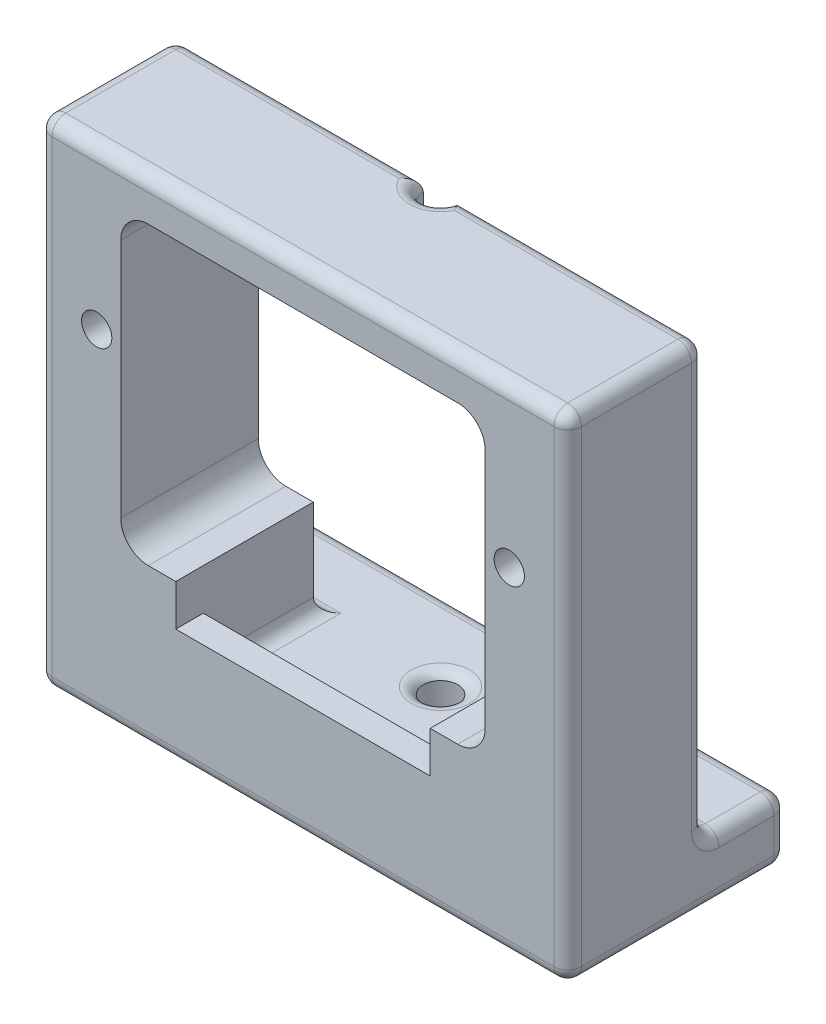
from build123d import *

# Parameters (mm, degrees)
SKETCH1_R           = 1.1
BOSS_EXTRUDE1_DEPTH = 10
SKETCH2_W           = 10
SKETCH2_H           = 8
SKETCH2_H_2         = 2
BOSS_EXTRUDE2_DEPTH = 4
SKETCH3_W           = 38.5
SKETCH3_H           = 10
BOSS_EXTRUDE3_DEPTH = 4.5
SKETCH4_W           = 38.5
SKETCH4_H           = 6
BOSS_EXTRUDE4_DEPTH = 4.5
SKETCH5_R           = 2.375
CUT_EXTRUDE1_DEPTH  = 4
SKETCH6_R           = 1.25
CUT_EXTRUDE2_DEPTH  = 39.659571907
FILLET1_R           = 1
FILLET2_R           = 1


with BuildPart() as part:
    # Sketch1 → Boss-Extrude1 (new body)
    with BuildSketch(Plane.XY):
        with BuildLine():
            ThreePointArc((-13.25, 8.75), (-12.664213562, 10.164213562), (-11.25, 10.75))
            Line((-11.25, 10.75), (11.25, 10.75))
            ThreePointArc((11.25, 10.75), (12.664213562, 10.164213562), (13.25, 8.75))
            Line((13.25, 8.75), (13.25, -8.75))
            ThreePointArc((13.25, -8.75), (12.664213562, -10.164213562), (11.25, -10.75))
            Line((11.25, -10.75), (9.25, -10.75))
            Line((9.25, -10.75), (9.25, -13.75))
            Line((9.25, -13.75), (19.25, -13.75))
            Line((19.25, -13.75), (19.25, 13.75))
            Line((19.25, 13.75), (-19.25, 13.75))
            Line((-19.25, 13.75), (-19.25, -13.75))
            Line((-19.25, -13.75), (-9.25, -13.75))
            Line((-9.25, -13.75), (-9.25, -10.75))
            Line((-9.25, -10.75), (-11.25, -10.75))
            ThreePointArc((-11.25, -10.75), (-12.664213562, -10.164213562), (-13.25, -8.75))
            Line((-13.25, -8.75), (-13.25, 8.75))
        make_face()
        with Locations((-15, 2.25)):
            Circle(SKETCH1_R, mode=Mode.SUBTRACT)
        with Locations((15, 2.25)):
            Circle(SKETCH1_R, mode=Mode.SUBTRACT)
    extrude(amount=BOSS_EXTRUDE1_DEPTH)

    # Sketch2 → Boss-Extrude2 (add)
    with BuildSketch(Plane.XZ.offset(13.75)):
        with Locations((-14.25, 4)):
            Rectangle(SKETCH2_W, SKETCH2_H)
        Polygon((9.25, 10), (-19.25, 10), (-19.25, 8), (-9.25, 8), (9.25, 8), align=None)
        with Locations((14.25, 9)):
            Rectangle(SKETCH2_W, SKETCH2_H_2)
        with Locations((14.25, 4)):
            Rectangle(SKETCH2_W, SKETCH2_H)
    extrude(amount=BOSS_EXTRUDE2_DEPTH)

    # Sketch3 → Boss-Extrude3 (add)
    with BuildSketch(Plane.XZ.offset(17.75)):
        with Locations((0, 5)):
            Rectangle(SKETCH3_W, SKETCH3_H)
    extrude(amount=BOSS_EXTRUDE3_DEPTH)

    # Sketch4 → Boss-Extrude4 (add)
    with BuildSketch(Plane.XZ.offset(22.25)):
        with Locations((0, -3)):
            Rectangle(SKETCH4_W, SKETCH4_H)
    extrude(amount=-BOSS_EXTRUDE4_DEPTH)

    # Sketch5 → Cut-Extrude1 (cut)
    with BuildSketch(Plane.XZ.offset(22.25)):
        with Locations(Location((0, 0, 0), (0, 0, 270))):
            Circle(SKETCH5_R)
    extrude(amount=-CUT_EXTRUDE1_DEPTH, mode=Mode.SUBTRACT)

    # Sketch6 → Cut-Extrude2 (cut, through all)
    with BuildSketch(Plane.XZ.offset(18.25)):
        with Locations(Location((0, 0, 0), (0, 0, 270))):
            Circle(SKETCH6_R)
    extrude(amount=-CUT_EXTRUDE2_DEPTH, mode=Mode.SUBTRACT)

    # Fillet1
    # the kernel refuses this fillet: 1 mm, written as the material it adds along each edge
    with BuildSketch(Plane(origin=(-19.25, -17.75, 0), x_dir=(0, 1, 0), z_dir=(1, 0, 0)), Plane(origin=(9.25, -17.75, 0), x_dir=(0, 1, 0), z_dir=(1, 0, 0))) as fillet1_piece_1:
        with BuildLine():
            CenterArc((FILLET1_R, -FILLET1_R), FILLET1_R, 90, 90)
            Line((0, -FILLET1_R), (0, 0))
            Line((0, 0), (FILLET1_R, 0))
        make_face()
    extrude(amount=10)
    with BuildSketch(Plane(origin=(-9.25, -17.75, 0), x_dir=(0, 1, 0), z_dir=(0, 0, 1))) as fillet1_piece_2:
        with BuildLine():
            CenterArc((FILLET1_R, -FILLET1_R), FILLET1_R, 90, 90)
            Line((0, -FILLET1_R), (0, 0))
            Line((0, 0), (FILLET1_R, 0))
        make_face()
    extrude(amount=8)
    with BuildSketch(Plane(origin=(-11.75, -17.75, 8), x_dir=(0, 0, -1), z_dir=(1, 0, 0))) as fillet1_piece_3:
        with BuildLine():
            CenterArc((FILLET1_R, FILLET1_R), FILLET1_R, 180, 90)
            Line((0, FILLET1_R), (0, 0))
            Line((0, 0), (FILLET1_R, 0))
        make_face()
    extrude(amount=23.5)
    with BuildSketch(Plane(origin=(9.25, -17.75, 8), x_dir=(-1, 0, 0), z_dir=(0, 0, -1))) as fillet1_piece_4:
        with BuildLine():
            CenterArc((FILLET1_R, FILLET1_R), FILLET1_R, 180, 90)
            Line((0, FILLET1_R), (0, 0))
            Line((0, 0), (FILLET1_R, 0))
        make_face()
    extrude(amount=8)
    with BuildSketch(Plane(origin=(-19.25, -17.75, 0), x_dir=(0, 1, 0), z_dir=(1, 0, 0))) as fillet1_piece_5a_section:
        with BuildLine():
            CenterArc((FILLET1_R, -FILLET1_R), FILLET1_R, 90, 90)
            Line((0, -FILLET1_R), (0, 0))
            Line((0, 0), (FILLET1_R, 0))
        make_face()
    fillet1_piece_5a = extrude(amount=12.5, mode=Mode.PRIVATE)
    fillet1_piece_5a = split(fillet1_piece_5a, bisect_by=Plane(origin=(-9.25, -17.75, 0), z_dir=(1, 0, 0)), keep=Keep.TOP, mode=Mode.PRIVATE)
    with BuildSketch(Plane(origin=(-9.25, -17.75, -2.5), x_dir=(0, 1, 0), z_dir=(0, 0, 1))) as fillet1_piece_5b_section:
        with BuildLine():
            CenterArc((FILLET1_R, -FILLET1_R), FILLET1_R, 90, 90)
            Line((0, -FILLET1_R), (0, 0))
            Line((0, 0), (FILLET1_R, 0))
        make_face()
    fillet1_piece_5b = extrude(amount=10.5, mode=Mode.PRIVATE)
    fillet1_piece_5b = split(fillet1_piece_5b, bisect_by=Plane(origin=(-9.25, -17.75, 0), z_dir=(0, 0, -1)), keep=Keep.TOP, mode=Mode.PRIVATE)
    fillet1_piece_5 = fillet1_piece_5a & fillet1_piece_5b
    add(fillet1_piece_5)
    with BuildSketch(Plane(origin=(6.75, -17.75, 0), x_dir=(0, 1, 0), z_dir=(1, 0, 0))) as fillet1_piece_6a_section:
        with BuildLine():
            CenterArc((FILLET1_R, -FILLET1_R), FILLET1_R, 90, 90)
            Line((0, -FILLET1_R), (0, 0))
            Line((0, 0), (FILLET1_R, 0))
        make_face()
    fillet1_piece_6a = extrude(amount=12.5, mode=Mode.PRIVATE)
    fillet1_piece_6a = split(fillet1_piece_6a, bisect_by=Plane(origin=(9.25, -17.75, 0), z_dir=(-1, 0, 0)), keep=Keep.TOP, mode=Mode.PRIVATE)
    with BuildSketch(Plane(origin=(9.25, -17.75, 8), x_dir=(-1, 0, 0), z_dir=(0, 0, -1))) as fillet1_piece_6b_section:
        with BuildLine():
            CenterArc((FILLET1_R, FILLET1_R), FILLET1_R, 180, 90)
            Line((0, FILLET1_R), (0, 0))
            Line((0, 0), (FILLET1_R, 0))
        make_face()
    fillet1_piece_6b = extrude(amount=10.5, mode=Mode.PRIVATE)
    fillet1_piece_6b = split(fillet1_piece_6b, bisect_by=Plane(origin=(9.25, -17.75, 0), z_dir=(0, 0, -1)), keep=Keep.TOP, mode=Mode.PRIVATE)
    fillet1_piece_6 = fillet1_piece_6a & fillet1_piece_6b
    add(fillet1_piece_6)
    # the kernel refuses this fillet: 1 mm, written as the material it takes off along each edge
    with BuildSketch(Plane(origin=(18.25, -21.25, -5), x_dir=(0, -1, 0), z_dir=(1, 0, 0))) as fillet1_2_piece_1_section:
        Polygon((0, 0), (FILLET1_R * 1.02, 0), (FILLET1_R * 1.02, FILLET1_R * 1.02), (0, FILLET1_R * 1.02), align=None)
    fillet1_2_piece_1 = extrude(amount=FILLET1_R * 1.02, mode=Mode.PRIVATE)
    fillet1_2_piece_1 = fillet1_2_piece_1 - Plane(origin=(18.25, -21.25, -5), x_dir=(0, 0.7071067811865475, 0.7071067811865475), z_dir=(1, 0, 0)) * Sphere(FILLET1_R, mode=Mode.PRIVATE)
    add(fillet1_2_piece_1, mode=Mode.SUBTRACT)
    with BuildSketch(Plane(origin=(-18.25, -21.25, -5), x_dir=(-1, 0, 0), z_dir=(0, -1, 0))) as fillet1_2_piece_2_section:
        Polygon((0, 0), (FILLET1_R * 1.02, 0), (FILLET1_R * 1.02, FILLET1_R * 1.02), (0, FILLET1_R * 1.02), align=None)
    fillet1_2_piece_2 = extrude(amount=FILLET1_R * 1.02, mode=Mode.PRIVATE)
    fillet1_2_piece_2 = fillet1_2_piece_2 - Plane(origin=(-18.25, -21.25, -5), x_dir=(0.7071067811865475, 0, 0.7071067811865475), z_dir=(0, -1, 0)) * Sphere(FILLET1_R, mode=Mode.PRIVATE)
    add(fillet1_2_piece_2, mode=Mode.SUBTRACT)
    with BuildSketch(Plane(origin=(-18.25, 12.75, 9), x_dir=(-1, 0, 0), z_dir=(0, 0, 1))) as fillet1_2_piece_3_section:
        Polygon((0, 0), (FILLET1_R * 1.02, 0), (FILLET1_R * 1.02, -FILLET1_R * 1.02), (0, -FILLET1_R * 1.02), align=None)
    fillet1_2_piece_3 = extrude(amount=FILLET1_R * 1.02, mode=Mode.PRIVATE)
    fillet1_2_piece_3 = fillet1_2_piece_3 - Plane(origin=(-18.25, 12.75, 9), x_dir=(0.7071067811865476, -0.7071067811865475, 0), z_dir=(0, 0, 1)) * Sphere(FILLET1_R, mode=Mode.PRIVATE)
    add(fillet1_2_piece_3, mode=Mode.SUBTRACT)
    with BuildSketch(Plane(origin=(18.25, 12.75, 9), x_dir=(0, 1, 0), z_dir=(1, 0, 0))) as fillet1_2_piece_4_section:
        Polygon((0, 0), (FILLET1_R * 1.02, 0), (FILLET1_R * 1.02, FILLET1_R * 1.02), (0, FILLET1_R * 1.02), align=None)
    fillet1_2_piece_4 = extrude(amount=FILLET1_R * 1.02, mode=Mode.PRIVATE)
    fillet1_2_piece_4 = fillet1_2_piece_4 - Plane(origin=(18.25, 12.75, 9), x_dir=(0, -0.7071067811865475, -0.7071067811865475), z_dir=(1, 0, 0)) * Sphere(FILLET1_R, mode=Mode.PRIVATE)
    add(fillet1_2_piece_4, mode=Mode.SUBTRACT)
    with BuildSketch(Plane(origin=(18.25, -22.25, -6), x_dir=(0, 1, 0), z_dir=(-1, 0, 0)), Plane(origin=(18.25, 13.75, 10), x_dir=(0, -1, 0), z_dir=(-1, 0, 0))) as fillet1_2_piece_5:
        with BuildLine():
            CenterArc((FILLET1_R, -FILLET1_R), FILLET1_R, 90, 90)
            Line((0, -FILLET1_R), (0, 0))
            Line((0, 0), (FILLET1_R, 0))
        make_face()
    extrude(amount=36.5, mode=Mode.SUBTRACT)
    with BuildSketch(Plane(origin=(21.75, -17.75, -6), x_dir=(0, 0, 1), z_dir=(-1, 0, 0))) as fillet1_2_piece_6:
        with BuildLine():
            CenterArc((FILLET1_R, -FILLET1_R), FILLET1_R, 90, 90)
            Line((0, -FILLET1_R), (0, 0))
            Line((0, 0), (FILLET1_R, 0))
        make_face()
    extrude(amount=43.5, mode=Mode.SUBTRACT)
    with BuildSketch(Plane(origin=(21.75, 13.75, 0), x_dir=(0, -1, 0), z_dir=(-1, 0, 0))) as fillet1_2_piece_7:
        with BuildLine():
            CenterArc((FILLET1_R, FILLET1_R), FILLET1_R, 180, 90)
            Line((0, FILLET1_R), (0, 0))
            Line((0, 0), (FILLET1_R, 0))
        make_face()
    extrude(amount=23, mode=Mode.SUBTRACT)
    with BuildSketch(Plane(origin=(0, 13.75, 0), x_dir=(0.003141587485879628, 0, -0.9999950652018581), z_dir=(-0.9999950652018581, 0, -0.003141587485879628))) as fillet1_2_piece_8:
        with BuildLine():
            CenterArc((1.25 + FILLET1_R, FILLET1_R), FILLET1_R, 180, 90)
            Line((1.25 + FILLET1_R, 0), (1.25, 0))
            Line((1.25, 0), (1.25, FILLET1_R))
        make_face()
    revolve(axis=Axis((0, 13.75, 0), (0, -1, 0)), revolution_arc=359.64, mode=Mode.SUBTRACT)
    with BuildSketch(Plane(origin=(0, -17.75, 0), x_dir=(0, 0, -1), z_dir=(-1, 0, 0))) as fillet1_2_piece_9:
        with BuildLine():
            CenterArc((2.116025404, 1), FILLET1_R, 210, 60)
            Line((1.25, 0.5), (1.25, 0))
            Line((1.25, 0), (2.116025404, 0))
        make_face()
    revolve(axis=Axis((0, -17.75, 0), (0, -1, 0)), mode=Mode.SUBTRACT)
    with BuildSketch(Plane(origin=(1.25, 13.75, 0), x_dir=(0, 0, 1), z_dir=(-1, 0, 0))) as fillet1_2_piece_10:
        with BuildLine():
            CenterArc((FILLET1_R, -FILLET1_R), FILLET1_R, 90, 90)
            Line((0, -FILLET1_R), (0, 0))
            Line((0, 0), (FILLET1_R, 0))
        make_face()
    extrude(amount=23, mode=Mode.SUBTRACT)
    with BuildSketch(Plane(origin=(-19.25, 13.75, -2.5), x_dir=(0, -1, 0), z_dir=(0, 0, 1))) as fillet1_2_piece_11:
        with BuildLine():
            CenterArc((FILLET1_R, FILLET1_R), FILLET1_R, 180, 90)
            Line((0, FILLET1_R), (0, 0))
            Line((0, 0), (FILLET1_R, 0))
        make_face()
    extrude(amount=11.5, mode=Mode.SUBTRACT)
    with BuildSketch(Plane(origin=(19.25, 13.75, -2.5), x_dir=(0, -1, 0), z_dir=(0, 0, 1))) as fillet1_2_piece_12:
        with BuildLine():
            CenterArc((FILLET1_R, -FILLET1_R), FILLET1_R, 90, 90)
            Line((0, -FILLET1_R), (0, 0))
            Line((0, 0), (FILLET1_R, 0))
        make_face()
    extrude(amount=11.5, mode=Mode.SUBTRACT)
    with BuildSketch(Plane(origin=(19.25, -24.75, 10), x_dir=(-1, 0, 0), z_dir=(0, 1, 0)), Plane(origin=(-19.25, 12.75, 10), x_dir=(1, 0, 0), z_dir=(0, -1, 0))) as fillet1_2_piece_13:
        with BuildLine():
            CenterArc((FILLET1_R, -FILLET1_R), FILLET1_R, 90, 90)
            Line((0, -FILLET1_R), (0, 0))
            Line((0, 0), (FILLET1_R, 0))
        make_face()
    extrude(amount=37.5, mode=Mode.SUBTRACT)
    with BuildSketch(Plane(origin=(-19.25, -22.25, -5), x_dir=(1, 0, 0), z_dir=(0, 0, 1))) as fillet1_2_piece_14:
        with BuildLine():
            CenterArc((FILLET1_R, FILLET1_R), FILLET1_R, 180, 90)
            Line((0, FILLET1_R), (0, 0))
            Line((0, 0), (FILLET1_R, 0))
        make_face()
    extrude(amount=17.5, mode=Mode.SUBTRACT)
    with BuildSketch(Plane(origin=(19.25, -22.25, 12.5), x_dir=(0, 1, 0), z_dir=(0, 0, -1))) as fillet1_2_piece_15:
        with BuildLine():
            CenterArc((FILLET1_R, -FILLET1_R), FILLET1_R, 90, 90)
            Line((0, -FILLET1_R), (0, 0))
            Line((0, 0), (FILLET1_R, 0))
        make_face()
    extrude(amount=17.5, mode=Mode.SUBTRACT)
    with BuildSketch(Plane(origin=(-19.25, -21.25, -6), x_dir=(1, 0, 0), z_dir=(0, 1, 0))) as fillet1_2_piece_16:
        with BuildLine():
            CenterArc((FILLET1_R, -FILLET1_R), FILLET1_R, 90, 90)
            Line((0, -FILLET1_R), (0, 0))
            Line((0, 0), (FILLET1_R, 0))
        make_face()
    extrude(amount=6, mode=Mode.SUBTRACT)
    with BuildSketch(Plane(origin=(19.25, -21.25, -6), x_dir=(-1, 0, 0), z_dir=(0, 1, 0))) as fillet1_2_piece_17:
        with BuildLine():
            CenterArc((FILLET1_R, FILLET1_R), FILLET1_R, 180, 90)
            Line((0, FILLET1_R), (0, 0))
            Line((0, 0), (FILLET1_R, 0))
        make_face()
    extrude(amount=6, mode=Mode.SUBTRACT)
    # the kernel refuses this fillet: 1 mm, written as the material it takes off along each edge
    with BuildSketch(Plane(origin=(18.25, 12.75, 1), x_dir=(1, 0, 0), z_dir=(0, 0, -1))) as fillet1_3_piece_1_section:
        Polygon((0, 0), (FILLET1_R * 1.02, 0), (FILLET1_R * 1.02, -FILLET1_R * 1.02), (0, -FILLET1_R * 1.02), align=None)
    fillet1_3_piece_1 = extrude(amount=FILLET1_R * 1.02, mode=Mode.PRIVATE)
    fillet1_3_piece_1 = fillet1_3_piece_1 - Plane(origin=(18.25, 12.75, 1), x_dir=(-0.7071067811865475, -0.7071067811865475, 0), z_dir=(0, 0, -1)) * Sphere(FILLET1_R, mode=Mode.PRIVATE)
    add(fillet1_3_piece_1, mode=Mode.SUBTRACT)
    with BuildSketch(Plane(origin=(-18.25, 12.75, 1), x_dir=(-1, 0, 0), z_dir=(0, 0, -1))) as fillet1_3_piece_2_section:
        Polygon((0, 0), (FILLET1_R * 1.02, 0), (FILLET1_R * 1.02, FILLET1_R * 1.02), (0, FILLET1_R * 1.02), align=None)
    fillet1_3_piece_2 = extrude(amount=FILLET1_R * 1.02, mode=Mode.PRIVATE)
    fillet1_3_piece_2 = fillet1_3_piece_2 - Plane(origin=(-18.25, 12.75, 1), x_dir=(0.7071067811865476, -0.7071067811865475, 0), z_dir=(0, 0, -1)) * Sphere(FILLET1_R, mode=Mode.PRIVATE)
    add(fillet1_3_piece_2, mode=Mode.SUBTRACT)
    with BuildSketch(Plane(origin=(18.25, -18.75, -5), x_dir=(0, 1, 0), z_dir=(1, 0, 0))) as fillet1_3_piece_3_section:
        Polygon((0, 0), (FILLET1_R * 1.02, 0), (FILLET1_R * 1.02, -FILLET1_R * 1.02), (0, -FILLET1_R * 1.02), align=None)
    fillet1_3_piece_3 = extrude(amount=FILLET1_R * 1.02, mode=Mode.PRIVATE)
    fillet1_3_piece_3 = fillet1_3_piece_3 - Plane(origin=(18.25, -18.75, -5), x_dir=(0, -0.7071067811865475, 0.7071067811865475), z_dir=(1, 0, 0)) * Sphere(FILLET1_R, mode=Mode.PRIVATE)
    add(fillet1_3_piece_3, mode=Mode.SUBTRACT)
    with BuildSketch(Plane(origin=(-18.25, -18.75, -5), x_dir=(0, 1, 0), z_dir=(-1, 0, 0))) as fillet1_3_piece_4_section:
        Polygon((0, 0), (FILLET1_R * 1.02, 0), (FILLET1_R * 1.02, FILLET1_R * 1.02), (0, FILLET1_R * 1.02), align=None)
    fillet1_3_piece_4 = extrude(amount=FILLET1_R * 1.02, mode=Mode.PRIVATE)
    fillet1_3_piece_4 = fillet1_3_piece_4 - Plane(origin=(-18.25, -18.75, -5), x_dir=(0, -0.7071067811865475, 0.7071067811865475), z_dir=(-1, 0, 0)) * Sphere(FILLET1_R, mode=Mode.PRIVATE)
    add(fillet1_3_piece_4, mode=Mode.SUBTRACT)
    with BuildSketch(Plane(origin=(-19.25, -17.75, -5), x_dir=(0, -1, 0), z_dir=(0, 0, 1)), Plane(origin=(19.25, -17.75, -1), x_dir=(0, -1, 0), z_dir=(0, 0, -1))) as fillet1_3_piece_5:
        with BuildLine():
            CenterArc((FILLET1_R, FILLET1_R), FILLET1_R, 180, 90)
            Line((0, FILLET1_R), (0, 0))
            Line((0, 0), (FILLET1_R, 0))
        make_face()
    extrude(amount=4, mode=Mode.SUBTRACT)
    with BuildSketch(Plane(origin=(-19.25, -16.75, 0), x_dir=(1, 0, 0), z_dir=(0, 1, 0)), Plane(origin=(19.25, 12.75, 0), x_dir=(-1, 0, 0), z_dir=(0, -1, 0))) as fillet1_3_piece_6:
        with BuildLine():
            CenterArc((FILLET1_R, -FILLET1_R), FILLET1_R, 90, 90)
            Line((0, -FILLET1_R), (0, 0))
            Line((0, 0), (FILLET1_R, 0))
        make_face()
    extrude(amount=29.5, mode=Mode.SUBTRACT)
    with BuildSketch(Plane(origin=(19.25, -16.75, -1), x_dir=(0, 0, 1), z_dir=(0, 1, 0))) as fillet1_3_piece_7:
        with BuildLine():
            CenterArc((1 + FILLET1_R, -FILLET1_R), FILLET1_R, 90, 90)
            Line((1, -FILLET1_R), (1, 0))
            Line((1, 0), (1 + FILLET1_R, 0))
        make_face()
    revolve(axis=Axis((19.25, -16.75, -1), (1, 0, 0)), revolution_arc=90, mode=Mode.SUBTRACT)
    with BuildSketch(Plane(origin=(-19.25, -16.75, -1), x_dir=(0, 0, 1), z_dir=(0, 1, 0))) as fillet1_3_piece_8:
        with BuildLine():
            CenterArc((1 + FILLET1_R, FILLET1_R), FILLET1_R, 180, 90)
            Line((1 + FILLET1_R, 0), (1, 0))
            Line((1, 0), (1, FILLET1_R))
        make_face()
    revolve(axis=Axis((-19.25, -16.75, -1), (1, 0, 0)), revolution_arc=90, mode=Mode.SUBTRACT)

    # Fillet2
    # the kernel refuses this fillet: 1 mm, written as the material it takes off along each edge
    with BuildSketch(Plane(origin=(18.25, -21.25, 9), x_dir=(0, -1, 0), z_dir=(0, 0, 1))) as fillet2_piece_1_section:
        Polygon((0, 0), (FILLET2_R, 0), (FILLET2_R, FILLET2_R), (0, FILLET2_R), align=None)
    fillet2_piece_1 = extrude(amount=FILLET2_R, mode=Mode.PRIVATE)
    fillet2_piece_1 = fillet2_piece_1 - Plane(origin=(18.25, -21.25, 9), x_dir=(-0.7071067811865475, 0.7071067811865475, 0), z_dir=(0, 0, 1)) * Sphere(FILLET2_R, mode=Mode.PRIVATE)
    add(fillet2_piece_1, mode=Mode.SUBTRACT)
    with BuildSketch(Plane(origin=(-18.25, -21.25, 9), x_dir=(0, -1, 0), z_dir=(0, 0, 1))) as fillet2_piece_2_section:
        Polygon((0, 0), (FILLET2_R, 0), (FILLET2_R, -FILLET2_R), (0, -FILLET2_R), align=None)
    fillet2_piece_2 = extrude(amount=FILLET2_R, mode=Mode.PRIVATE)
    fillet2_piece_2 = fillet2_piece_2 - Plane(origin=(-18.25, -21.25, 9), x_dir=(0.7071067811865475, 0.7071067811865475, 0), z_dir=(0, 0, 1)) * Sphere(FILLET2_R, mode=Mode.PRIVATE)
    add(fillet2_piece_2, mode=Mode.SUBTRACT)
    with BuildSketch(Plane(origin=(-18.25, -22.25, 10), x_dir=(0, 1, 0), z_dir=(1, 0, 0))) as fillet2_piece_3:
        with BuildLine():
            CenterArc((FILLET2_R, -FILLET2_R), FILLET2_R, 90, 90)
            Line((0, -FILLET2_R), (0, 0))
            Line((0, 0), (FILLET2_R, 0))
        make_face()
    extrude(amount=36.5, mode=Mode.SUBTRACT)


solid = part.part
